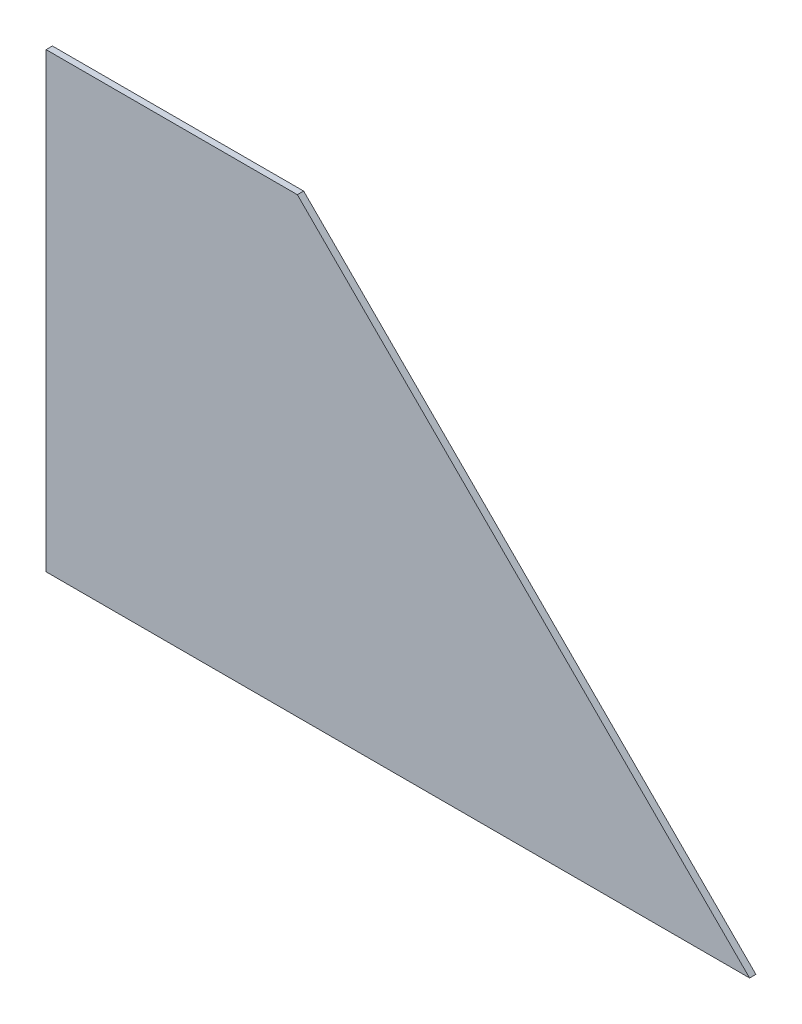
from build123d import *

# Parameters (mm, degrees)
BOSS_EXTRUDE1_DEPTH = 3.175


with BuildPart() as part:
    # Sketch1 → Boss-Extrude1 (new body)
    with BuildSketch(Plane.XY):
        Polygon((127, 228.6), (355.6, 0), (127, 0), (0, 0), (0, 228.6), align=None)
    extrude(amount=BOSS_EXTRUDE1_DEPTH)


solid = part.part
